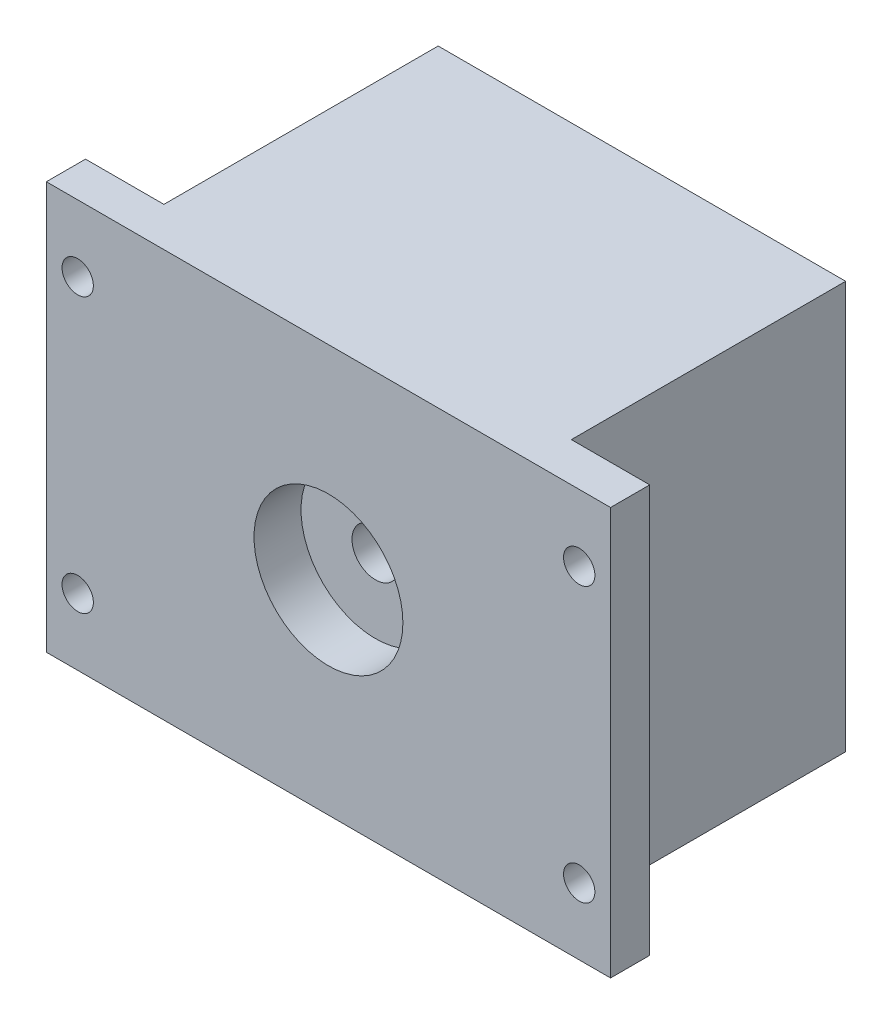
from build123d import *

# Parameters (mm, degrees)
SKETCH3_W           = 52
SKETCH3_H           = 52
BOSS_EXTRUDE1_DEPTH = 40
SKETCH4_R           = 3
CUT_EXTRUDE5_DEPTH  = 40
SKETCH4_5_R         = 9.5
SKETCH4_5_R_2       = 3
CUT_EXTRUDE6_DEPTH  = 6
CUT_EXTRUDE8_START  = -6
SKETCH5_R           = 9.5
CUT_EXTRUDE8_DEPTH  = 6
SKETCH6_W           = 10
SKETCH6_H           = 52
BOSS_EXTRUDE2_DEPTH = 5
SKETCH7_R           = 2
CUT_EXTRUDE9_DEPTH  = 5


with BuildPart() as part:
    # Sketch3 → Boss-Extrude1 (new body)
    with BuildSketch(Plane.XY):
        Rectangle(SKETCH3_W, SKETCH3_H)
    extrude(amount=BOSS_EXTRUDE1_DEPTH)

    # Sketch4 → Cut-Extrude5 (cut)
    with BuildSketch(Plane.XY.offset(40)):
        Circle(SKETCH4_R)
    extrude(amount=-CUT_EXTRUDE5_DEPTH, mode=Mode.SUBTRACT)

    # Sketch4<5> → Cut-Extrude6 (cut)
    with BuildSketch(Plane.XY.offset(40)):
        Circle(SKETCH4_5_R)
        Circle(SKETCH4_5_R_2, mode=Mode.SUBTRACT)
    extrude(amount=-CUT_EXTRUDE6_DEPTH, mode=Mode.SUBTRACT)

    # Sketch5 → Cut-Extrude8 (cut)
    with BuildSketch(Plane(origin=(0, 0, 0), x_dir=(-1, 0, 0), z_dir=(0, 0, -1)).offset(CUT_EXTRUDE8_START)):
        Circle(SKETCH5_R)
    extrude(amount=CUT_EXTRUDE8_DEPTH, mode=Mode.SUBTRACT)

    # Sketch6 → Boss-Extrude2 (add)
    with BuildSketch(Plane.XY.offset(40)):
        with Locations((31, 0)):
            Rectangle(SKETCH6_W, SKETCH6_H)
        with Locations((-31, 0)):
            Rectangle(SKETCH6_W, SKETCH6_H)
    extrude(amount=-BOSS_EXTRUDE2_DEPTH)

    # Sketch7 → Cut-Extrude9 (cut)
    with BuildSketch(Plane(origin=(0, 0, 35), x_dir=(-1, 0, 0), z_dir=(0, 0, -1))):
        with Locations((-32, 17.5)):
            Circle(SKETCH7_R)
        with Locations((32, 17.5)):
            Circle(SKETCH7_R)
        with Locations((32, -17.5)):
            Circle(SKETCH7_R)
        with Locations((-32, -17.5)):
            Circle(SKETCH7_R)
    extrude(amount=-CUT_EXTRUDE9_DEPTH, mode=Mode.SUBTRACT)


solid = part.part
